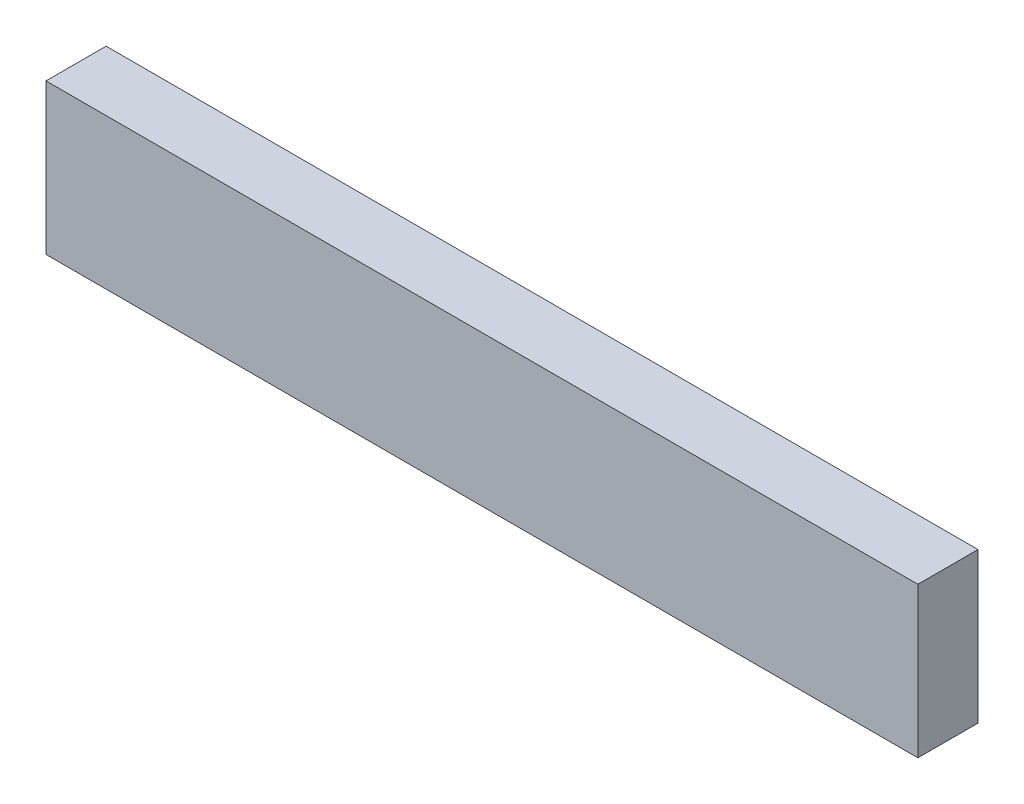
from build123d import *

# Parameters (mm, degrees)
SKETCH1_W                       = 39
SKETCH1_H                       = 155
BOSS_EXTRUDE1_DEPTH             = 2
BOSS_EXTRUDE2_DEPTH             = 38
SKETCH3_W                       = 2
SKETCH3_H                       = 2
BOSS_EXTRUDE3_DEPTH             = 38
SKETCH4_W                       = 2
SKETCH4_H                       = 2
BOSS_EXTRUDE4_DEPTH             = 151
SKETCH6_W                       = 35
SKETCH6_H                       = 2.2
CUT_EXTRUDE1_DEPTH              = 160.340045186
SKETCH7_W                       = 35
SKETCH7_H                       = 2.2
CUT_EXTRUDE2_DEPTH              = 89.490112442
SKETCH5_W                       = 31
SKETCH5_H                       = 2
BOSS_EXTRUDE5_DEPTH             = 2
BOSS_EXTRUDE6_REACH             = 91.367
SKETCH8_W                       = 2
SKETCH8_H                       = 2
BOSS_EXTRUDE6_DIRECTION_2_REACH = 91.367
SKETCH10_W                      = 2
SKETCH10_H                      = 2.2
SKETCH10_W_2                    = 2.2
SKETCH10_H_2                    = 2
BOSS_EXTRUDE8_DEPTH             = 2
SKETCH11_W                      = 2
SKETCH11_H                      = 2.2
SKETCH11_W_2                    = 2.2
SKETCH11_H_2                    = 2
BOSS_EXTRUDE9_DEPTH             = 2
FILLET2_R                       = 2.5
SKETCH14_W                      = 36.5
SKETCH14_H                      = 7.75
BOSS_EXTRUDE10_DEPTH            = 2
SKETCH13_W                      = 31
SKETCH13_H                      = 3
CUT_EXTRUDE4_DEPTH              = 2
FILLET3_R                       = 2
FILLET4_R                       = 0.5
SKETCH15_R                      = 5.1
CUT_EXTRUDE5_DEPTH              = 90.367219941
SKETCH16_R                      = 7.1
BOSS_EXTRUDE11_DEPTH            = 1
FILLET5_R                       = 0.5
FILLET7_R                       = 0.5
CUT_EXTRUDE6_DEPTH              = 6
SKETCH18_W                      = 29
SKETCH18_H                      = 3
CUT_EXTRUDE8_DEPTH              = 90.367219986
CUT_EXTRUDE11_DEPTH             = 90.367219986
CUT_EXTRUDE11_DEPTH_BACK        = 90.367219986
SKETCH20_W                      = 5
SKETCH20_H                      = 40
CUT_EXTRUDE12_DEPTH             = 43.594013664
CUT_EXTRUDE12_DEPTH_BACK        = 43.594013664
SKETCH21_W                      = 29
SKETCH21_H                      = 8.2
SKETCH22_W                      = 29
SKETCH22_H                      = 17.8
CUT_EXTRUDE13_DEPTH             = 36.0069993


with BuildPart() as part:
    # Sketch1 → Boss-Extrude1 (new body)
    with BuildSketch(Plane(origin=(0, 0, 0), x_dir=(1, 0, 0), z_dir=(0, 1, 0))):
        Rectangle(SKETCH1_W, SKETCH1_H)
    extrude(amount=BOSS_EXTRUDE1_DEPTH)

    # Sketch2 → Boss-Extrude2 (add)
    with BuildSketch(Plane(origin=(0, 2, 0), x_dir=(1, 0, 0), z_dir=(0, 1, 0))):
        Polygon((-17.5, -77.5), (-17.5, -75.5), (-17.5, 75.5), (17.5, 75.5), (17.5, -75.5), (17.5, -77.5), (19.5, -77.5), (19.5, 77.5), (-19.5, 77.5), (-19.5, -77.5), align=None)
    extrude(amount=BOSS_EXTRUDE2_DEPTH)

    # Sketch3 → Boss-Extrude3 (add)
    with BuildSketch(Plane(origin=(0, 2, 0), x_dir=(1, 0, 0), z_dir=(0, 1, 0))):
        with Locations((-16.5, -76.5)):
            Rectangle(SKETCH3_W, SKETCH3_H)
        with Locations((-16.5, -72.3)):
            Rectangle(SKETCH3_W, SKETCH3_H)
        with Locations((16.5, -76.5)):
            Rectangle(SKETCH3_W, SKETCH3_H)
        with Locations((16.5, -72.3)):
            Rectangle(SKETCH3_W, SKETCH3_H)
    extrude(amount=BOSS_EXTRUDE3_DEPTH)

    # Sketch4 → Boss-Extrude4 (add)
    with BuildSketch(Plane.XY.offset(-75.5)):
        with Locations((-16.5, 39)):
            Rectangle(SKETCH4_W, SKETCH4_H)
        Polygon((-15.5, 33.8), (-17.5, 31.8), (-17.5, 35.8), (-15.5, 35.8), align=None)
        Polygon((15.5, 35.8), (17.5, 35.8), (17.5, 31.8), (15.5, 33.8), align=None)
        with Locations((16.5, 39)):
            Rectangle(SKETCH4_W, SKETCH4_H)
    extrude(amount=BOSS_EXTRUDE4_DEPTH)

    # Sketch6 → Cut-Extrude1 (cut, through all)
    with BuildSketch(Plane.XY.offset(-75.5)):
        with Locations((0, 36.9)):
            Rectangle(SKETCH6_W, SKETCH6_H)
    extrude(amount=CUT_EXTRUDE1_DEPTH, mode=Mode.SUBTRACT)

    # Sketch7 → Cut-Extrude2 (cut, through all)
    with BuildSketch(Plane(origin=(0, 2, 0), x_dir=(1, 0, 0), z_dir=(0, 1, 0))):
        with Locations((0, -74.4)):
            Rectangle(SKETCH7_W, SKETCH7_H)
    extrude(amount=CUT_EXTRUDE2_DEPTH, mode=Mode.SUBTRACT)

    # Sketch5 → Boss-Extrude5 (add)
    with BuildSketch(Plane(origin=(0, 2, 0), x_dir=(1, 0, 0), z_dir=(0, 1, 0))):
        with Locations((0, -76.5)):
            Rectangle(SKETCH5_W, SKETCH5_H)
        with Locations((0, -72.3)):
            Rectangle(SKETCH5_W, SKETCH5_H)
    extrude(amount=BOSS_EXTRUDE5_DEPTH)

    # Boss-Extrude6: up to this face of the body (flat: up to its plane)
    boss_extrude6_end = Plane(part.part.faces().sort_by_distance((17.5, 16.9, -2.1))[0])
    # Sketch8 → Boss-Extrude6 (add, up to the picked face)
    with BuildSketch(Plane(origin=(0, 0, 0), x_dir=(0, 0, -1), z_dir=(1, 0, 0)), mode=Mode.PRIVATE) as boss_extrude6_sk1:
        with Locations((74.5, 39)):
            Rectangle(SKETCH8_W, SKETCH8_H)
    boss_extrude6_tool1 = split(extrude(boss_extrude6_sk1.sketch, amount=BOSS_EXTRUDE6_REACH, mode=Mode.PRIVATE), bisect_by=boss_extrude6_end, keep=Keep.BOTH, mode=Mode.PRIVATE)
    # Sketch8 → Boss-Extrude6 (add, up to the picked face)
    with BuildSketch(Plane(origin=(0, 0, 0), x_dir=(0, 0, -1), z_dir=(1, 0, 0)), mode=Mode.PRIVATE) as boss_extrude6_sk2:
        Polygon((75.5, 35.8), (73.5, 35.8), (73.5, 33.8), (75.5, 31.8), align=None)
    boss_extrude6_tool2 = split(extrude(boss_extrude6_sk2.sketch, amount=BOSS_EXTRUDE6_REACH, mode=Mode.PRIVATE), bisect_by=boss_extrude6_end, keep=Keep.BOTH, mode=Mode.PRIVATE)
    add(boss_extrude6_tool1.solids().sort_by(Axis((0, 39, -74.5), (1, 0, 0)))[0])
    add(boss_extrude6_tool2.solids().sort_by(Axis((0, 34.244444, -74.611111), (1, 0, 0)))[0])

    # Boss-Extrude6 direction 2: up to this face of the body (flat: up to its plane)
    boss_extrude6_direction_2_end = Plane(part.part.faces().sort_by_distance((-17.5, 16.9, -2.1))[0])
    # Sketch8 → Boss-Extrude6 direction 2 (add, up to the picked face)
    with BuildSketch(Plane(origin=(0, 0, 0), x_dir=(0, 0, -1), z_dir=(1, 0, 0)), mode=Mode.PRIVATE) as boss_extrude6_direction_2_sk1:
        with Locations((74.5, 39)):
            Rectangle(SKETCH8_W, SKETCH8_H)
    boss_extrude6_direction_2_tool1 = split(extrude(boss_extrude6_direction_2_sk1.sketch, amount=-BOSS_EXTRUDE6_DIRECTION_2_REACH, mode=Mode.PRIVATE), bisect_by=boss_extrude6_direction_2_end, keep=Keep.BOTH, mode=Mode.PRIVATE)
    # Sketch8 → Boss-Extrude6 direction 2 (add, up to the picked face)
    with BuildSketch(Plane(origin=(0, 0, 0), x_dir=(0, 0, -1), z_dir=(1, 0, 0)), mode=Mode.PRIVATE) as boss_extrude6_direction_2_sk2:
        Polygon((75.5, 35.8), (73.5, 35.8), (73.5, 33.8), (75.5, 31.8), align=None)
    boss_extrude6_direction_2_tool2 = split(extrude(boss_extrude6_direction_2_sk2.sketch, amount=-BOSS_EXTRUDE6_DIRECTION_2_REACH, mode=Mode.PRIVATE), bisect_by=boss_extrude6_direction_2_end, keep=Keep.BOTH, mode=Mode.PRIVATE)
    add(boss_extrude6_direction_2_tool1.solids().sort_by(Axis((0, 39, -74.5), (-1, 0, 0)))[0])
    add(boss_extrude6_direction_2_tool2.solids().sort_by(Axis((0, 34.244444, -74.611111), (-1, 0, 0)))[0])

    # Sketch10 → Boss-Extrude8 (add)
    with BuildSketch(Plane(origin=(-17.5, 0, 0), x_dir=(0, 0, -1), z_dir=(1, 0, 0))):
        with Locations((-76.5, 36.9)):
            Rectangle(SKETCH10_W, SKETCH10_H)
        with Locations((-74.4, 39)):
            Rectangle(SKETCH10_W_2, SKETCH10_H_2)
    extrude(amount=BOSS_EXTRUDE8_DEPTH)

    # Sketch11 → Boss-Extrude9 (add)
    with BuildSketch(Plane.ZY.offset(-17.5)):
        with Locations((76.5, 36.9)):
            Rectangle(SKETCH11_W, SKETCH11_H)
        with Locations((74.4, 39)):
            Rectangle(SKETCH11_W_2, SKETCH11_H_2)
    extrude(amount=BOSS_EXTRUDE9_DEPTH)

    # Fillet2
    fillet2_edges = [part.edges().sort_by_distance(p)[0] for p in [
        (-17.5, 16.9, 71.3),
        (17.5, 16.9, 71.3),
        (19.5, 20, 77.5),
        (-19.5, 20, 77.5),
        (-19.5, 20, -77.5),
        (-17.5, 16.9, -75.5),
        (17.5, 16.9, -75.5),
        (19.5, 20, -77.5),
        (19.5, 40, 0),
        (-19.5, 40, 0),
        (19.5, 0, 0),
        (-19.5, 0, 0),
        (0, 40, -77.5),
        (0, 0, 77.5),
        (0, 0, -77.5),
        (-17.5, 40, 77.5),
        (17.5, 40, 77.5),
    ]]
    fillet(fillet2_edges, radius=FILLET2_R)

    # Sketch14 → Boss-Extrude10 (add)
    with BuildSketch(Plane.XY.offset(-75.5)):
        with Locations((0, 5.125)):
            Rectangle(SKETCH14_W, SKETCH14_H)
    extrude(amount=BOSS_EXTRUDE10_DEPTH)

    # Sketch13 → Cut-Extrude4 (cut)
    with BuildSketch(Plane(origin=(0, 0, -77.5), x_dir=(-1, 0, 0), z_dir=(0, 0, -1))):
        with Locations((0, 5.5)):
            Rectangle(SKETCH13_W, SKETCH13_H)
    extrude(amount=-CUT_EXTRUDE4_DEPTH, mode=Mode.SUBTRACT)

    # Fillet3
    fillet3_edges = [part.edges().sort_by_distance(p)[0] for p in [
        (0, 9, -73.5),
    ]]
    fillet(fillet3_edges, radius=FILLET3_R - 0.0001)  # a hair under: the kernel refuses the full size

    # Fillet4
    fillet4_edges = [part.edges().sort_by_distance(p)[0] for p in [
        (15.5, 5.5, -75.5),
        (15.5, 4, -76.5),
        (0, 7, -75.5),
        (15.5, 7, -76.5),
        (-15.5, 5.5, -75.5),
        (-15.5, 7, -76.5),
        (0, 4, -75.5),
        (-15.5, 4, -76.5),
        (15.5, 5.5, -77.5),
        (0, 4, -77.5),
        (-15.5, 5.5, -77.5),
        (0, 7, -77.5),
    ]]
    fillet(fillet4_edges, radius=FILLET4_R)

    # Sketch15 → Cut-Extrude5 (cut, through all)
    with BuildSketch(Plane.XZ):
        with Locations(Location((0, 38.75, 0), (0, 0, 270))):
            Circle(SKETCH15_R)
        with Locations(Location((0, -38.75, 0), (0, 0, 270))):
            Circle(SKETCH15_R)
    extrude(amount=-CUT_EXTRUDE5_DEPTH, mode=Mode.SUBTRACT)

    # Sketch16 → Boss-Extrude11 (add)
    with BuildSketch(Plane(origin=(0, 2, 0), x_dir=(1, 0, 0), z_dir=(0, 1, 0))):
        with Locations(Location((0, 38.75, 0), (0, 0, 270))):
            Circle(SKETCH16_R)
        with Locations(Location((0, -38.75, 0), (0, 0, 270))):
            Circle(SKETCH16_R)
    extrude(amount=BOSS_EXTRUDE11_DEPTH)

    # Fillet5
    fillet5_edges = [part.edges().sort_by_distance(p)[0] for p in [
        (0, 2, -45.85),
        (0, 3, -45.85),
        (0, 2, 31.65),
        (0, 3, 31.65),
    ]]
    fillet(fillet5_edges, radius=FILLET5_R - 0.0001)  # a hair under: the kernel refuses the full size

    # Fillet7
    fillet7_edges = [part.edges().sort_by_distance(p)[0] for p in [
        (15.5, 40, 0.75),
        (0, 4, 77.5),
        (0, 40, -73.5),
        (-15.5, 40, 0.75),
        (-15.5, 20.75, 77.5),
        (-15.5, 39.267766953, 76.767766953),
        (15.5, 20.75, 77.5),
        (15.5, 39.267766953, 76.767766953),
    ]]
    fillet(fillet7_edges, radius=FILLET7_R)

    # Sketch17 → Cut-Extrude6 (cut)
    with BuildSketch(Plane.XZ):
        Polygon((-17, -77.5), (-17, 70.299999999), (-14.999999999, 71.3), (-14.999999999, 77.5), (14.999999999, 77.5), (14.999999999, 71.3), (17, 70.299999999), (17, -77.5), align=None)
    extrude(amount=-CUT_EXTRUDE6_DEPTH, mode=Mode.SUBTRACT)

    # Sketch18 → Cut-Extrude8 (cut, through all)
    with BuildSketch(Plane.XY):
        with Locations((0, 7.5)):
            Rectangle(SKETCH18_W, SKETCH18_H)
    extrude(amount=-CUT_EXTRUDE8_DEPTH, mode=Mode.SUBTRACT)

    # Sketch20 → Cut-Extrude11 (cut, two sides: drawn at the far end of the back side and taken through both)
    with BuildSketch(Plane.XY.offset(-CUT_EXTRUDE11_DEPTH_BACK)):
        Polygon((19.5, 40), (14.5, 40), (14.5, 6), (14.5, 0), (19.5, 0), align=None)
        with Locations((-17, 20)):
            Rectangle(SKETCH20_W, SKETCH20_H)
    extrude(amount=CUT_EXTRUDE11_DEPTH + CUT_EXTRUDE11_DEPTH_BACK, mode=Mode.SUBTRACT)

    # Sketch21 → Cut-Extrude12 (cut, two sides: drawn at the far end of the back side and taken through both)
    with BuildSketch(Plane.XY.offset(-75.5).offset(-CUT_EXTRUDE12_DEPTH_BACK)):
        with Locations((0, 35.9)):
            Rectangle(SKETCH21_W, SKETCH21_H)
    extrude(amount=CUT_EXTRUDE12_DEPTH + CUT_EXTRUDE12_DEPTH_BACK, mode=Mode.SUBTRACT)

    # Sketch22 → Cut-Extrude13 (cut, through all)
    with BuildSketch(Plane.XY.offset(-75.5)):
        with Locations((0, 17.9)):
            Rectangle(SKETCH22_W, SKETCH22_H)
    extrude(amount=-CUT_EXTRUDE13_DEPTH, mode=Mode.SUBTRACT)


solid = part.part
